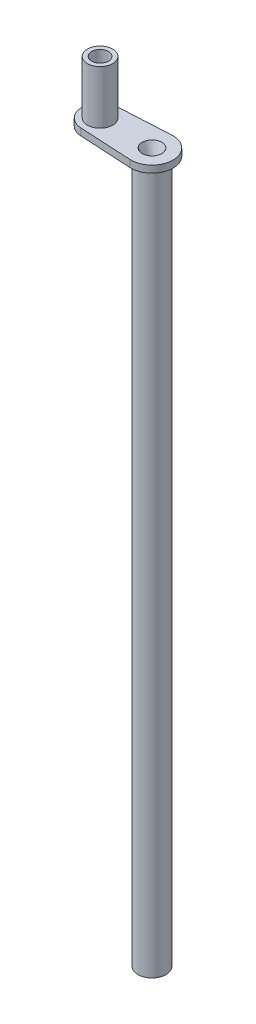
from build123d import *

# Parameters (mm, degrees)
CROQUIS2_R              = 5
SALIENTE_EXTRUIR1_DEPTH = 250
SALIENTE_EXTRUIR2_DEPTH = 2.5
CROQUIS11_R             = 4.5
SALIENTE_EXTRUIR3_DEPTH = 19
CORTAR_EXTRUIR1_REACH   = 276.178
CROQUIS12_R             = 3


with BuildPart() as part:
    # Croquis2 → Saliente-Extruir1 (new body)
    with BuildSketch(Plane(origin=(0, 0, 0), x_dir=(1, 0, 0), z_dir=(0, 1, 0))):
        with Locations(Location((-11.975261547, 2.214603163, 0), (0, 0, 270))):
            Circle(CROQUIS2_R)
    extrude(amount=SALIENTE_EXTRUIR1_DEPTH)

    # Cortar-Recubrir1: read off the stored shape, not the designer's step
    # Cortar-Recubrir1: loft between two sections, ruled curve by curve
    cortar_recubrir1_from = [
        Edge.make_bspline([(-12.756084652, 7, -1.589850989), (-14.005589, 7, -3.151497198), (-12.443942791, 7, -4.401001547), (-11.194438443, 7, -2.839355337), (-9.944934094, 7, -1.277709127), (-11.506580304, 7, -0.028204779), (-12.756084652, 7, -1.589850989)], [0, 0, 0, 0, 0.5, 0.5, 0.5, 1, 1, 1, 1], 3, [1, 0.333333333, 0.333333333, 1, 0.333333333, 0.333333333, 1]),
    ]
    cortar_recubrir1_to = [
        Edge.make_bspline([(-14.386979714, 0, 0.976574595), (-20.76933523, 0, -3.846861738), (-15.945898897, 0, -10.229217255), (-9.563543381, 0, -5.405780921), (-3.181187864, 0, -0.582344588), (-8.004624198, 0, 5.800010929), (-14.386979714, 0, 0.976574595)], [0, 0, 0, 0, 0.5, 0.5, 0.5, 1, 1, 1, 1], 3, [1, 0.333333333, 0.333333333, 1, 0.333333333, 0.333333333, 1]),
    ]
    cortar_recubrir1 = Solid(Shell([*[Face.make_surface_from_curves(cortar_recubrir1_from[k], cortar_recubrir1_to[k]) for k in range(1)], Face(Wire(cortar_recubrir1_from)), Face(Wire(cortar_recubrir1_to))]))
    add(cortar_recubrir1, mode=Mode.SUBTRACT)

    # Croquis7 → Saliente-Extruir2 (add)
    with BuildSketch(Plane(origin=(0, 250, 0), x_dir=(1, 0, 0), z_dir=(0, 1, 0))):
        with BuildLine():
            Line((-30.826612899, 8.705100234), (-12.380666953, 9.703638245))
            ThreePointArc((-12.380666953, 9.703638245), (-4.475261547, 2.214603163), (-12.380666953, -5.274431919))
            Line((-12.380666953, -5.274431919), (-30.826612899, -4.275893908))
            ThreePointArc((-30.826612899, -4.275893908), (-36.975261547, 2.214603163), (-30.826612899, 8.705100234))
        make_face()
    extrude(amount=SALIENTE_EXTRUIR2_DEPTH)

    # Cortar-Recubrir2: read off the stored shape, not the designer's step
    # Cortar-Recubrir2: loft between two sections, ruled curve by curve
    cortar_recubrir2_from = [
        Edge.make_bspline([(-12.878746512, 244.5, -2.643222947), (-13.735986079, 244.5, -0.836253018), (-11.92901615, 244.5, 0.02098655), (-11.071776583, 244.5, -1.785983379), (-10.214537015, 244.5, -3.592953308), (-12.021506944, 244.5, -4.450192876), (-12.878746512, 244.5, -2.643222947)], [0, 0, 0, 0, 0.5, 0.5, 0.5, 1, 1, 1, 1], 3, [1, 0.333333333, 0.333333333, 1, 0.333333333, 0.333333333, 1]),
    ]
    cortar_recubrir2_to = [
        Edge.make_bspline([(-14.629528251, 252.5, 0.066814876), (-10.066692174, 252.5, 5.375348283), (-4.758158767, 252.5, 0.812512206), (-9.320994844, 252.5, -4.496021201), (-13.883830921, 252.5, -9.804554608), (-19.192364328, 252.5, -5.241718531), (-14.629528251, 252.5, 0.066814876)], [0, 0, 0, 0, 0.5, 0.5, 0.5, 1, 1, 1, 1], 3, [1, 0.333333333, 0.333333333, 1, 0.333333333, 0.333333333, 1]),
    ]
    cortar_recubrir2 = Solid(Shell([*[Face.make_surface_from_curves(cortar_recubrir2_from[k], cortar_recubrir2_to[k]) for k in range(1)], Face(Wire(cortar_recubrir2_from)), Face(Wire(cortar_recubrir2_to))]))
    add(cortar_recubrir2, mode=Mode.SUBTRACT)

    # Croquis11 → Saliente-Extruir3 (add)
    with BuildSketch(Plane(origin=(0, 252.5, 0), x_dir=(1, 0, 0), z_dir=(0, 1, 0))):
        with Locations(Location((-30.475261547, 2.214603163, 0), (0, 0, 270))):
            Circle(CROQUIS11_R)
    extrude(amount=SALIENTE_EXTRUIR3_DEPTH)

    # Croquis12 → Cortar-Extruir1 (cut, up to next)
    with BuildSketch(Plane(origin=(0, 271.5, 0), x_dir=(1, 0, 0), z_dir=(0, 1, 0)), mode=Mode.PRIVATE) as cortar_extruir1_sk1:
        with Locations(Location((-30.475261547, 2.214603163, 0), (0, 0, 270))):
            Circle(CROQUIS12_R)
    cortar_extruir1_tool1 = extrude(cortar_extruir1_sk1.sketch, amount=-CORTAR_EXTRUIR1_REACH, mode=Mode.PRIVATE) & part.part
    add(cortar_extruir1_tool1.solids().sort_by_distance((-30.475262, 271.5, -2.214603))[0], mode=Mode.SUBTRACT)


solid = part.part
